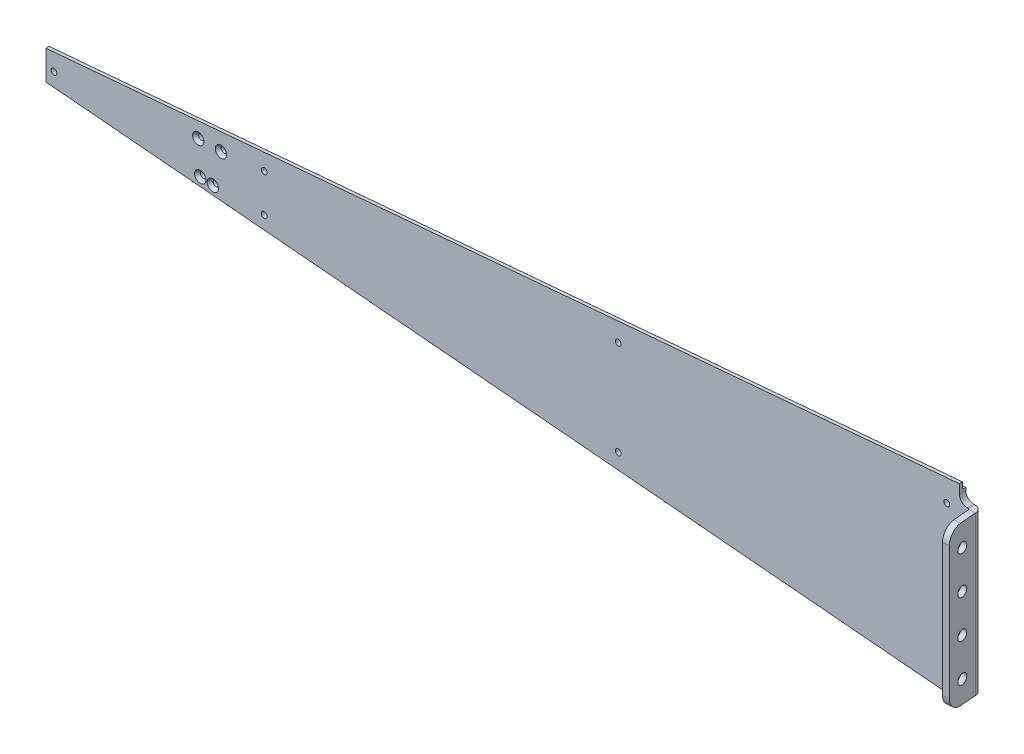
from build123d import *

# Parameters (mm, degrees)
BASE_FLANGE1_DEPTH                            = 3.175
SKETCHED_START                                = -39.6875
SKETCHED_BEND2_DEPTH                          = 79.375
SKETCHED_BEND2_2_DEPTH                        = 79.375
SKETCHED_START_2                              = 554.168566106
SKETCHED_BEND2_3_DEPTH                        = 4.831433894
EXTRUDE3_DEPTH                                = 1.5748
F_9_0_196_DIAMETER_HOLE1_D                    = 4.9784
F_9_0_196_DIAMETER_HOLE1_CSINK_D              = 5.715
F_9_0_196_DIAMETER_HOLE1_CSINK_ANGLE          = 90
CHAMFER1_SIZE                                 = 0.889
F_0_116_DIAMETER_HOLE1_D                      = 2.9464
CSK_FOR_4_FLAT_HEAD_MACHINE_SCREW1_AT_2_COUNT = 2
CSK_FOR_4_FLAT_HEAD_MACHINE_SCREW1_AT_2_PITCH = 16.160968319
CSK_FOR_4_FLAT_HEAD_MACHINE_SCREW1_AT_3_COUNT = 2
CSK_FOR_4_FLAT_HEAD_MACHINE_SCREW1_AT_3_PITCH = 11.43
CSK_FOR_4_FLAT_HEAD_MACHINE_SCREW1_AT_4_COUNT = 2
CSK_FOR_4_FLAT_HEAD_MACHINE_SCREW1_AT_4_PITCH = 18.194716953


with BuildPart() as part:
    # Base-Flange1: sheet metal written as solids
    # Sketch1 → Base-Flange1 (new body)
    with BuildSketch(Plane.XY):
        with BuildLine():
            Line((93.6498, 4.974967896), (552.323, 44.950411579))
            Line((552.323, 44.950411579), (552.323, 43.6499))
            ThreePointArc((552.323, 43.6499), (553.48356009, 40.84806009), (556.2854, 39.6875))
            Line((556.2854, 39.6875), (568.198, 39.6875))
            ThreePointArc((568.198, 39.6875), (572.688128061, 37.827628061), (574.548, 33.3375))
            Line((574.548, 33.3375), (574.548, -33.3375))
            ThreePointArc((574.548, -33.3375), (572.688128061, -37.827628061), (568.198, -39.6875))
            Line((568.198, -39.6875), (556.2854, -39.6875))
            ThreePointArc((556.2854, -39.6875), (553.48356009, -40.84806009), (552.323, -43.6499))
            Line((552.323, -43.6499), (552.323, -46.531181284))
            Line((552.323, -46.531181284), (93.6498, -6.555737601))
            Line((93.6498, -6.555737601), (93.6498, 4.974967896))
        make_face()
    extrude(amount=-BASE_FLANGE1_DEPTH)

    # Sketched Bend2: read off the stored shape, not the designer's step
    # Sketched Bend2 outline → Sketched Bend2 (cut)
    with BuildSketch(Plane(origin=(0, 0, 0), x_dir=(1, 0, 0), z_dir=(0, 1, 0)).offset(SKETCHED_START)):
        with BuildLine():
            ThreePointArc((556.949152286, 3.175), (559.367160247, 2.270079642), (560.596949567, 0))
            Line((560.596949567, 0), (574.548, 0))
            Line((574.548, 0), (574.548, 3.175))
            Line((574.548, 3.175), (556.949152286, 3.175))
        make_face()
    extrude(amount=SKETCHED_BEND2_DEPTH, mode=Mode.SUBTRACT)

    # Sketched Bend2 2 outline → Sketched Bend2 2 (add)
    with BuildSketch(Plane(origin=(0, 0, 0), x_dir=(1, 0, 0), z_dir=(0, 1, 0)).offset(SKETCHED_START)):
        with BuildLine():
            Line((557.455219193, -0.463724883), (558.718115569, -14.89869652))
            Line((558.718115569, -14.89869652), (561.881033736, -14.621977036))
            Line((561.881033736, -14.621977036), (560.618137359, -0.187005399))
            ThreePointArc((560.618137359, -0.187005399), (560.608738158, -0.09336734), (560.596949567, 0))
            Line((560.596949567, 0), (556.949152286, 0))
            ThreePointArc((556.949152286, 0), (557.292352112, -0.133463113), (557.455219193, -0.463724883))
        make_face()
    extrude(amount=SKETCHED_BEND2_2_DEPTH)

    # Sketched Bend2 3 outline → Sketched Bend2 3 (cut)
    with BuildSketch(Plane(origin=(0, 0, 0), x_dir=(0, 1, 0), z_dir=(0.9961946980917459, 0, -0.0871557427476548)).offset(SKETCHED_START_2)):
        with BuildLine():
            Line((39.6875, 63.537494831), (33.3375, 63.53749483))
            ThreePointArc((33.3375, 63.53749483), (37.827628061, 61.677622891), (39.6875, 57.18749483))
            Line((39.6875, 57.18749483), (39.6875, 63.537494831))
        make_face()
        with BuildLine():
            ThreePointArc((-39.6875, 57.18749483), (-37.827628061, 61.677622891), (-33.3375, 63.53749483))
            Line((-33.3375, 63.53749483), (-39.6875, 63.537494831))
            Line((-39.6875, 63.537494831), (-39.6875, 57.18749483))
        make_face()
    extrude(amount=SKETCHED_BEND2_3_DEPTH, mode=Mode.SUBTRACT)

    # Sketch6 → Extrude3 (add)
    with BuildSketch(Plane.XY):
        Polygon((93.6498, 2.425339339), (93.6498, 8.162003592), (552.323, 48.137447275), (552.323, 42.400783022), align=None)
    extrude(amount=-EXTRUDE3_DEPTH)

    # #9 (0.196) Diameter Hole1 (through all)
    with Locations(Plane(origin=(553.180458015, 0, -48.39701896), x_dir=(0.08715574274765482, 0, 0.9961946980917459), z_dir=(-0.9961946980917459, 0, 0.08715574274765482))):
        with Locations((56.40009483, 9.525), (56.40009483, 28.575), (56.40009483, -28.575), (56.40009483, -9.525)):
            CounterSinkHole(F_9_0_196_DIAMETER_HOLE1_D / 2, F_9_0_196_DIAMETER_HOLE1_CSINK_D / 2, counter_sink_angle=F_9_0_196_DIAMETER_HOLE1_CSINK_ANGLE)

    # Chamfer1
    chamfer1_edges = [part.edges().sort_by_distance(p)[0] for p in [
        (322.9864, -26.543459443, -3.175),
    ]]
    chamfer(chamfer1_edges, length=CHAMFER1_SIZE)

    # 0.116_ Diameter Hole1 (through all)
    with Locations(Plane(origin=(0, 0, -3.175), x_dir=(-1, 0, 0), z_dir=(0, 0, -1))):
        with Locations((-381, 23.8125), (-381, -23.8125), (-203.2, 9.525), (-203.2, -9.525), (-97.6376, 0), (-545.973, 36.5125), (-545.973, -36.5125)):
            Hole(F_0_116_DIAMETER_HOLE1_D / 2)

    # Sketch15 → CSK for #4 Flat Head Machine Screw1 (revolve, cut)
    with BuildSketch(Plane(origin=(170.0784, 7.112, 0), x_dir=(0, -1, 0), z_dir=(1, 0, 0))):
        Polygon((0, 0), (0, 3.175), (1.4732, 3.175), (1.4732, 1.592454986), (2.8575, 0), align=None)
    csk_for_4_flat_head_machine_screw1 = revolve(axis=Axis((170.0784, 7.112, 6.35), (0, 0, -1)), mode=Mode.SUBTRACT)

    # CSK for #4 Flat Head Machine Screw1 at 2: CSK for #4 Flat Head Machine Screw1 ×2
    with Locations(*[Vector(0.06286752006193388, -0.998021880983209, 0) * (i * CSK_FOR_4_FLAT_HEAD_MACHINE_SCREW1_AT_2_PITCH) for i in range(1, CSK_FOR_4_FLAT_HEAD_MACHINE_SCREW1_AT_2_COUNT)]):
        add(csk_for_4_flat_head_machine_screw1, mode=Mode.SUBTRACT)

    # CSK for #4 Flat Head Machine Screw1 at 3: CSK for #4 Flat Head Machine Screw1 ×2
    with Locations(*[(i * CSK_FOR_4_FLAT_HEAD_MACHINE_SCREW1_AT_3_PITCH, 0, 0) for i in range(1, CSK_FOR_4_FLAT_HEAD_MACHINE_SCREW1_AT_3_COUNT)]):
        add(csk_for_4_flat_head_machine_screw1, mode=Mode.SUBTRACT)

    # CSK for #4 Flat Head Machine Screw1 at 4: CSK for #4 Flat Head Machine Screw1 ×2
    with Locations(*[Vector(0.4048427914006695, -0.9143863047153069, 0) * (i * CSK_FOR_4_FLAT_HEAD_MACHINE_SCREW1_AT_4_PITCH) for i in range(1, CSK_FOR_4_FLAT_HEAD_MACHINE_SCREW1_AT_4_COUNT)]):
        add(csk_for_4_flat_head_machine_screw1, mode=Mode.SUBTRACT)


solid = part.part
